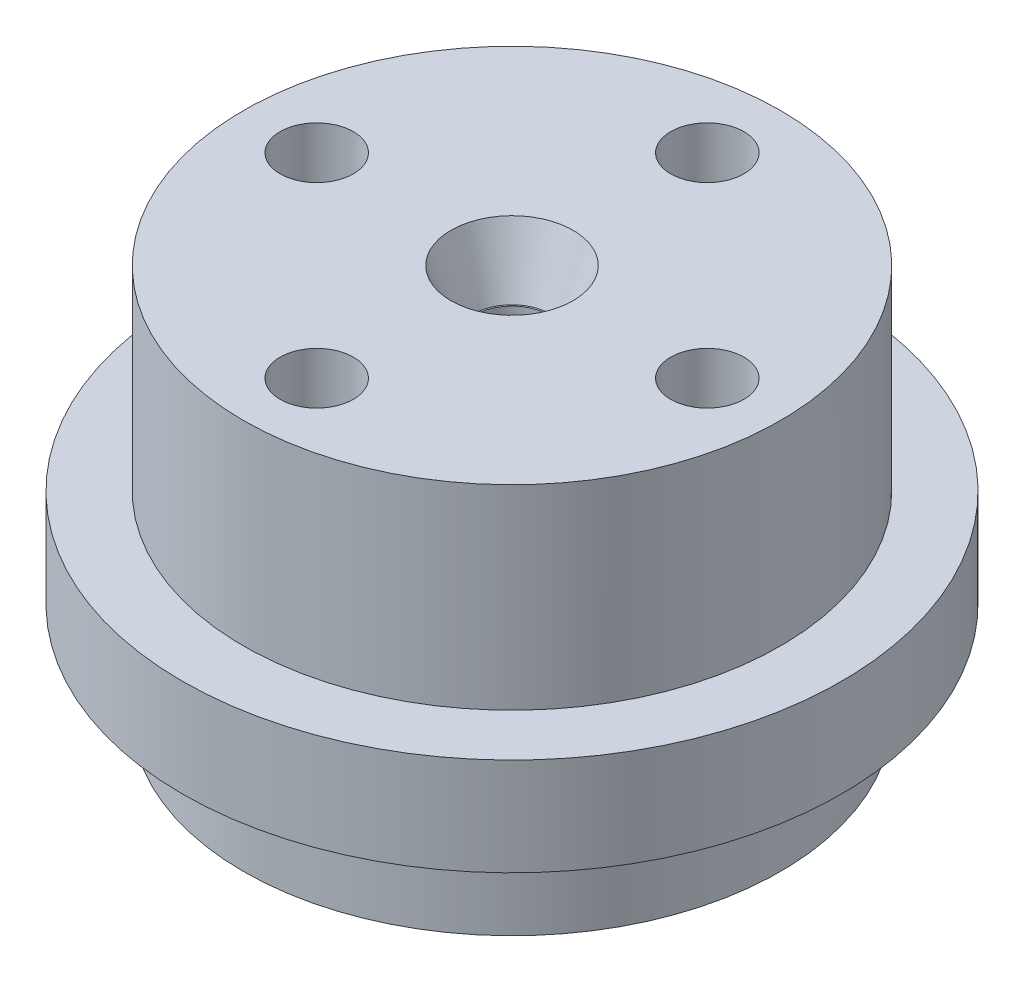
from build123d import *

# Parameters (mm, degrees)
SKETCH1_R                = 11
BOSS_EXTRUDE1_DEPTH      = 16
SKETCH2_R                = 1.5
CUT_EXTRUDE1_DEPTH       = 23.315913604
SKETCH3_R                = 2.5
CUT_EXTRUDE2_DEPTH       = 2.5
CUT_EXTRUDE2_DRAFT       = -20.5
BOSS_EXTRUDE2_DEPTH      = 2
BOSS_EXTRUDE2_DEPTH_BACK = 2
SKETCH5_R                = 13.5
SKETCH7_R                = 1.5
CUT_EXTRUDE3_DEPTH       = 25.909837414


with BuildPart() as part:
    # Sketch1 → Boss-Extrude1 (new body)
    with BuildSketch(Plane(origin=(0, 0, 0), x_dir=(1, 0, 0), z_dir=(0, 1, 0))):
        Circle(SKETCH1_R)
    extrude(amount=BOSS_EXTRUDE1_DEPTH)

    # Sketch2 → Cut-Extrude1 (cut, through all)
    with BuildSketch(Plane(origin=(0, 16, 0), x_dir=(1, 0, 0), z_dir=(0, 1, 0))):
        Circle(SKETCH2_R)
    extrude(amount=-CUT_EXTRUDE1_DEPTH, mode=Mode.SUBTRACT)


with BuildPart() as cut_extrude2_tool:
    # Sketch3 → Cut-Extrude2 (with draft: the straight prism first)
    with BuildSketch(Plane(origin=(0, 16, 0), x_dir=(1, 0, 0), z_dir=(0, 1, 0))):
        Circle(SKETCH3_R)
    extrude(amount=-CUT_EXTRUDE2_DEPTH)
    # Cut-Extrude2: the draft: its side faces are tilted about the plane it starts from
    cut_extrude2_sides = [cut_extrude2_tool.faces().sort_by_distance(p)[0] for p in [
        (-2.5, 14.75, 0),
    ]]
    draft(cut_extrude2_sides, Plane(origin=(0, 16, 0), x_dir=(1, 0, 0), z_dir=(0, 1, 0)), CUT_EXTRUDE2_DRAFT)


with BuildPart() as part_1:
    add(part.part)

    # Cut-Extrude2: cut by cut_extrude2_tool
    add(cut_extrude2_tool.part, mode=Mode.SUBTRACT)

    # Sketch5 → Boss-Extrude2 (add, two sides: drawn at the far end of the back side and taken through both)
    with BuildSketch(Plane(origin=(0, 6, 0), x_dir=(-1, 0, 0), z_dir=(0, -1, 0)).offset(-BOSS_EXTRUDE2_DEPTH_BACK)):
        Circle(SKETCH5_R)
    extrude(amount=BOSS_EXTRUDE2_DEPTH + BOSS_EXTRUDE2_DEPTH_BACK)

    # Sketch7 → Cut-Extrude3 (cut, through all)
    with BuildSketch(Plane(origin=(0, 16, 0), x_dir=(1, 0, 0), z_dir=(0, 1, 0))):
        with Locations((0, 8)):
            Circle(SKETCH7_R)
        with Locations((8, 0)):
            Circle(SKETCH7_R)
        with Locations((0, -8)):
            Circle(SKETCH7_R)
        with Locations((-8, 0)):
            Circle(SKETCH7_R)
    extrude(amount=-CUT_EXTRUDE3_DEPTH, mode=Mode.SUBTRACT)


solid = part_1.part
